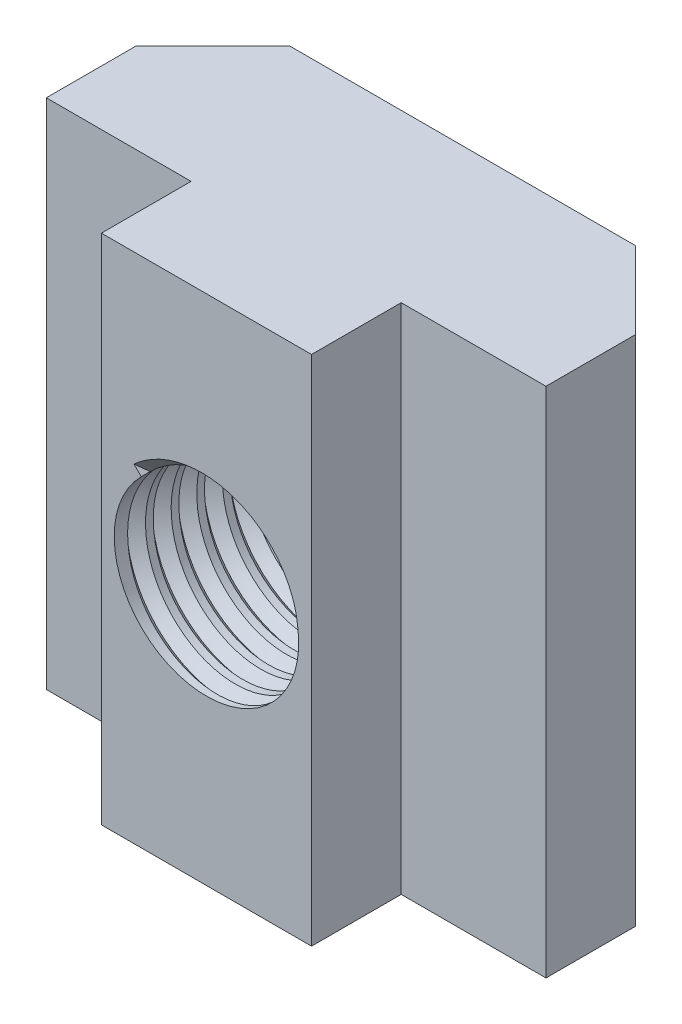
from build123d import *

# Parameters (mm, degrees)
SKETCH_1_W          = 19.5
SKETCH_1_H          = 20
EXTRUDE_1_DEPTH     = 6.5
SKETCH_2_W          = 8.2
SKETCH_2_H          = 20
EXTRUDE_2_DEPTH     = 3.5
CHAMFER_1_SIZE      = 3
SKETCH_3_R          = 3.6
CUT_EXTRUDE_1_DEPTH = 18.177383386
SWEEP_1_PITCH       = 1


with BuildPart() as part:
    # 草图1 → 凸台-拉伸1 (new body)
    with BuildSketch(Plane.XY):
        Rectangle(SKETCH_1_W, SKETCH_1_H)
    extrude(amount=EXTRUDE_1_DEPTH)

    # 草图2 → 凸台-拉伸2 (add)
    with BuildSketch(Plane.XY.offset(6.5)):
        Rectangle(SKETCH_2_W, SKETCH_2_H)
    extrude(amount=EXTRUDE_2_DEPTH)

    # 倒角1
    chamfer_1_edges = [part.edges().sort_by_distance(p)[0] for p in [
        (-9.75, 0, 0),
        (9.75, 0, 0),
    ]]
    chamfer(chamfer_1_edges, length=CHAMFER_1_SIZE)

    # 草图3 → 切除-拉伸1 (cut, through all)
    with BuildSketch(Plane.XY.offset(10)):
        Circle(SKETCH_3_R)
    extrude(amount=-CUT_EXTRUDE_1_DEPTH, mode=Mode.SUBTRACT)

    # 切除-扫描1: arcs per turn and ends read off the stored shape
    # 切除-扫描1: the profile of 草图5 profile screwed along a right-hand helix through 10 turns, 8 arcs to a turn; built about Z, then put on its axis
    sweep_1_z = Axis((0, 0, 0), (0, 0, 1))
    sweep_1_corners = [(3.5997, 0, 0.350262505), (3.5997, 0, -0.350262495), (4, 0, 5e-09)]
    with BuildLine(mode=Mode.PRIVATE) as sweep_1_profile:
        Line(sweep_1_corners[0], sweep_1_corners[1])
        Line(sweep_1_corners[1], sweep_1_corners[2])
        Line(sweep_1_corners[2], sweep_1_corners[0])
    sweep_1_cap = Face(sweep_1_profile.wire())
    sweep_1_turn_angles = [0, 22.5, 45, 67.5, 90, 112.5, 135, 157.5, 180, 202.5, 225, 247.5, 270, 292.5, 315, 337.5, 360]
    sweep_1_turn_weights = [1, 0.9238795325112867, 1, 0.9238795325112867, 1, 0.9238795325112867, 1, 0.9238795325112867, 1, 0.9238795325112867, 1, 0.9238795325112867, 1, 0.9238795325112867, 1, 0.9238795325112867, 1]
    sweep_1_turn_rails = [Edge.make_bspline([Vector(p[0], p[1], 0).rotate(sweep_1_z, sweep_1_turn_angles[k]) / sweep_1_turn_weights[k] + Vector(0, 0, p[2] + SWEEP_1_PITCH * sweep_1_turn_angles[k] / 360) for k in range(17)], [0, 0, 0, 1, 1, 2, 2, 3, 3, 4, 4, 5, 5, 6, 6, 7, 7, 8, 8, 8], 2, sweep_1_turn_weights) for p in sweep_1_corners]
    sweep_1_turn_sides = [Face.make_surface_from_curves(sweep_1_turn_rails[p[0]], sweep_1_turn_rails[p[1]]) for p in [(0, 1), (1, 2), (2, 0)]]
    sweep_1 = Plane(origin=(0, 0, 10), x_dir=(-0.7071067811865512, 0.7071067811865438, 0), z_dir=(0, 0, -1)) * Solid(Shell([*[p.moved(Location((0, 0, SWEEP_1_PITCH * i))) for i in range(10) for p in sweep_1_turn_sides], sweep_1_cap, sweep_1_cap.rotate(sweep_1_z, 3600).moved(Location((0, 0, SWEEP_1_PITCH * 3600 / 360)))]))
    add(sweep_1, mode=Mode.SUBTRACT)


solid = part.part
